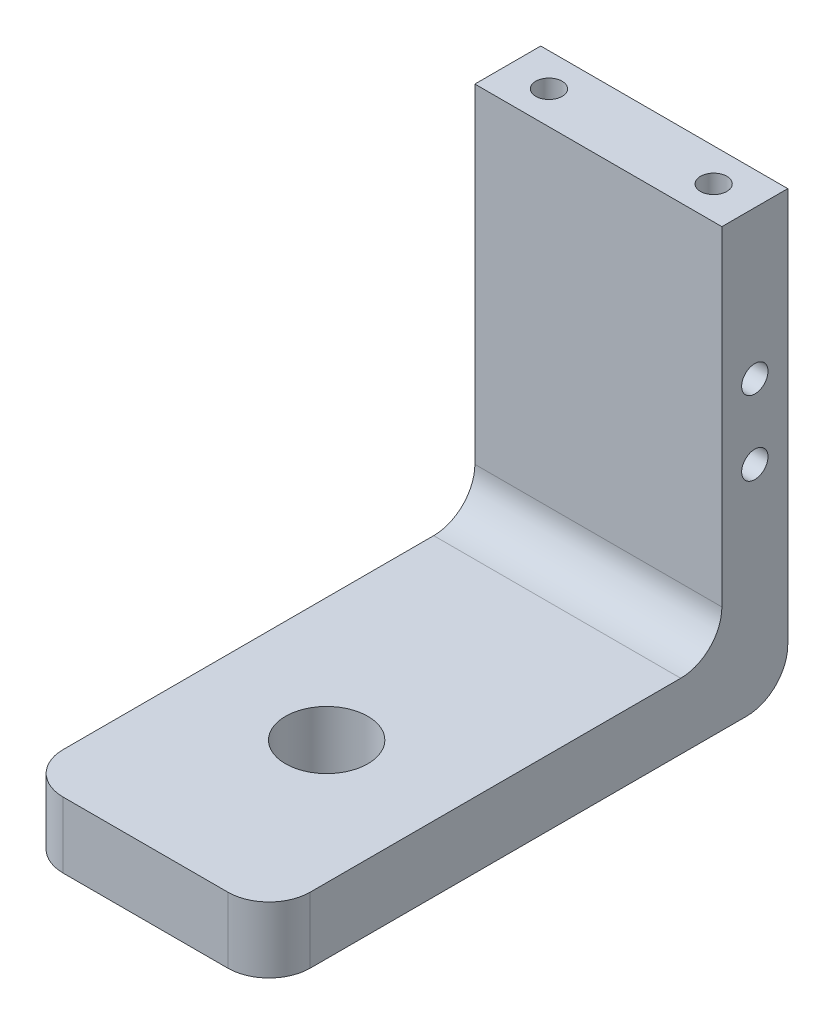
from build123d import *

# Parameters (mm, degrees)
SKETCH1_W           = 63
SKETCH1_H           = 8
BOSS_EXTRUDE1_DEPTH = 30
SKETCH2_W           = 30
SKETCH2_H           = 8
BOSS_EXTRUDE2_DEPTH = 45
SKETCH3_R           = 5
CUT_EXTRUDE1_DEPTH  = 84.030115019
SKETCH4_R           = 1.6
CUT_EXTRUDE2_DEPTH  = 88.624197571
SKETCH5_R           = 1.6
CUT_EXTRUDE3_DEPTH  = 14
FILLET1_R           = 5


with BuildPart() as part:
    # Sketch1 → Boss-Extrude1 (new body)
    with BuildSketch(Plane(origin=(0, 0, 0), x_dir=(0, 0, -1), z_dir=(1, 0, 0))):
        with Locations((31.5, 4)):
            Rectangle(SKETCH1_W, SKETCH1_H)
    extrude(amount=BOSS_EXTRUDE1_DEPTH)

    # Sketch2 → Boss-Extrude2 (add)
    with BuildSketch(Plane(origin=(0, 8, 0), x_dir=(1, 0, 0), z_dir=(0, 1, 0))):
        with Locations((15, 59)):
            Rectangle(SKETCH2_W, SKETCH2_H)
    extrude(amount=BOSS_EXTRUDE2_DEPTH)

    # Sketch3 → Cut-Extrude1 (cut, through all)
    with BuildSketch(Plane(origin=(0, 8, 0), x_dir=(1, 0, 0), z_dir=(0, 1, 0))):
        with Locations((15, 22)):
            Circle(SKETCH3_R)
    extrude(amount=-CUT_EXTRUDE1_DEPTH, mode=Mode.SUBTRACT)

    # Sketch4 → Cut-Extrude2 (cut, through all)
    with BuildSketch(Plane(origin=(30, 0, 0), x_dir=(0, 0, -1), z_dir=(1, 0, 0))):
        with Locations((59, 35)):
            Circle(SKETCH4_R)
        with Locations((59, 26)):
            Circle(SKETCH4_R)
    extrude(amount=-CUT_EXTRUDE2_DEPTH, mode=Mode.SUBTRACT)

    # Sketch5 → Cut-Extrude3 (cut)
    with BuildSketch(Plane(origin=(0, 53, 0), x_dir=(1, 0, 0), z_dir=(0, 1, 0))):
        with Locations((5, 59)):
            Circle(SKETCH5_R)
        with Locations((25, 59)):
            Circle(SKETCH5_R)
    extrude(amount=-CUT_EXTRUDE3_DEPTH, mode=Mode.SUBTRACT)

    # Fillet1
    fillet1_edges = [part.edges().sort_by_distance(p)[0] for p in [
        (15, 0, -63),
        (15, 8, -55),
        (30, 4, 0),
        (0, 4, 0),
    ]]
    fillet(fillet1_edges, radius=FILLET1_R)


solid = part.part
